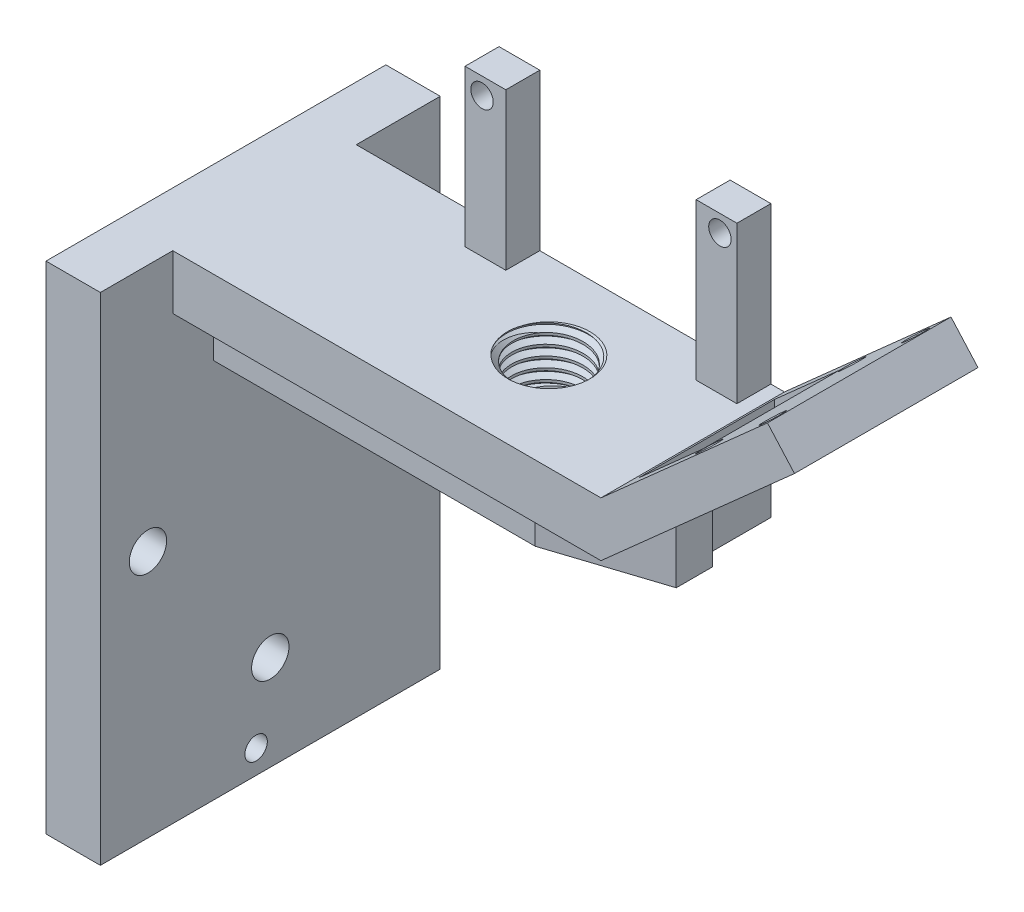
from build123d import *

# Parameters (mm, degrees)
BOSS_EXTRUDE2_DEPTH              = 17
FILLET4_R                        = 2
CUT_EXTRUDE3_DEPTH               = 54.344060179
CUT_EXTRUDE3_DEPTH_BACK          = 10
SKETCH5_R                        = 2.1
CUT_EXTRUDE4_DEPTH               = 54.344060179
FILLET5_R                        = 1
FILLET6_R                        = 1
CUT_EXTRUDE5_START               = -21
SKETCH7_W                        = 27.995529744
SKETCH7_H                        = 10
CUT_EXTRUDE5_DEPTH               = 8
SKETCH11_W                       = 70.995529744
SKETCH11_H                       = 8
BOSS_EXTRUDE4_DEPTH              = 27
M12X1_5_TAPPED_HOLE2_D           = 10.5
M12X1_5_TAPPED_HOLE2_CSINK_D     = 12.05
M12X1_5_TAPPED_HOLE2_CSINK_ANGLE = 90
THREAD1_PITCH                    = 1.5
BOSS_EXTRUDE9_REACH              = 61.78
SKETCH18_W                       = 6.15
SKETCH18_H                       = 9
SKETCH18_W_2                     = 10.891165303
BOSS_EXTRUDE10_DEPTH             = 5
SKETCH27_R                       = 1.65
CUT_EXTRUDE7_DEPTH               = 5
BOSS_EXTRUDE11_DEPTH             = 25
BOSS_EXTRUDE11_DEPTH_BACK        = 25
SKETCH28_W                       = 8
SKETCH28_H                       = 73
BOSS_EXTRUDE13_DEPTH             = 9
SKETCH30_R                       = 2.75
CUT_EXTRUDE8_DEPTH               = 25
BOSS_EXTRUDE14_START             = -12.65
BOSS_EXTRUDE14_DEPTH             = 27
SKETCH32_W                       = 9.502872963
SKETCH32_H                       = 20
CUT_EXTRUDE9_DEPTH               = 96.698444648
SKETCH34_R                       = 1.65
CUT_EXTRUDE10_DEPTH              = 5
SKETCH35_R                       = 1.65
CUT_EXTRUDE11_DEPTH              = 5


with BuildPart() as part:
    # Sketch2 → Boss-Extrude2 (new body)
    with BuildSketch(Plane(origin=(0, 10, 0), x_dir=(1, 0, 0), z_dir=(0, 1, 0))):
        Polygon((10.15, 21), (33.86, 21), (44.46, 11.73), (45.995529744, 10.387135781), (45.995529744, 5.080374985), (42.88, 4.07), (30.33, 0), (0, 0), (0, 10), align=None)
    extrude(amount=BOSS_EXTRUDE2_DEPTH)

    # Fillet4
    fillet4_edges = [part.edges().sort_by_distance(p)[0] for p in [
        (33.86, 18.5, -21),
    ]]
    fillet(fillet4_edges, radius=FILLET4_R)

    # Sketch5 → Cut-Extrude3 (cut, two sides: drawn at the far end of the back side and taken through both)
    with BuildSketch(Plane.XZ.offset(-10).offset(-CUT_EXTRUDE3_DEPTH_BACK)):
        with Locations(Location((4.5, -8.35, 0), (0, 0, 90))):
            Circle(SKETCH5_R)
        with Locations(Location((41.5, -8.35, 0), (0, 0, 90))):
            Circle(SKETCH5_R)
    extrude(amount=CUT_EXTRUDE3_DEPTH + CUT_EXTRUDE3_DEPTH_BACK, mode=Mode.SUBTRACT)

    # Sketch6 → Cut-Extrude4 (cut, through all)
    with BuildSketch(Plane.XZ.offset(-10)):
        with BuildLine():
            Line((6.75, -3.5), (29.776655589, -3.5))
            Line((29.776655589, -3.5), (37.633396178, -6.047962884))
            ThreePointArc((37.633396178, -6.047962884), (37.09151083, -9.252897134), (38.849712422, -11.986753463))
            Line((38.849712422, -11.986753463), (32.545460719, -17.5))
            Line((32.545460719, -17.5), (11.682803109, -17.5))
            Line((11.682803109, -17.5), (6.80567095, -12.214438054))
            ThreePointArc((6.80567095, -12.214438054), (8.999884249, -8.317723876), (6.75, -4.452885683))
            Line((6.75, -4.452885683), (6.75, -3.5))
        make_face()
    extrude(amount=-CUT_EXTRUDE4_DEPTH, mode=Mode.SUBTRACT)

    # Fillet5
    fillet5_edges = [part.edges().sort_by_distance(p)[0] for p in [
        (6.75, 18.5, -4.452885683),
    ]]
    fillet(fillet5_edges, radius=FILLET5_R)
    fillet5_2_edges = [part.edges().sort_by_distance(p)[0] for p in [
        (6.75, 18.5, -3.5),
    ]]
    fillet(fillet5_2_edges, radius=FILLET5_R - 0.0001)  # a hair under: the kernel refuses the full size

    # Fillet6
    fillet6_edges = [part.edges().sort_by_distance(p)[0] for p in [
        (29.776655589, 18.5, -3.5),
        (37.633396178, 18.5, -6.047962884),
        (38.849712422, 18.5, -11.986753463),
        (32.545460719, 18.5, -17.5),
        (11.682803109, 18.5, -17.5),
        (6.80567095, 18.5, -12.214438054),
    ]]
    fillet(fillet6_edges, radius=FILLET6_R)

    # Sketch7 → Cut-Extrude5 (cut)
    with BuildSketch(Plane(origin=(0, 0, -21), x_dir=(-1, 0, 0), z_dir=(0, 0, -1)).offset(CUT_EXTRUDE5_START)):
        with Locations((-22.997764872, 18.5)):
            Rectangle(SKETCH7_W, SKETCH7_H)
    extrude(amount=CUT_EXTRUDE5_DEPTH, mode=Mode.SUBTRACT)

    # Sketch11 → Boss-Extrude4 (add)
    with BuildSketch(Plane.XY.offset(-21)):
        with Locations((10.497764872, 23)):
            Rectangle(SKETCH11_W, SKETCH11_H)
    extrude(amount=BOSS_EXTRUDE4_DEPTH)

    # M12x1.5 Tapped Hole2 (through all)
    with Locations(Plane(origin=(0, 27, 0), x_dir=(1, 0, 0), z_dir=(0, 1, 0))):
        with Locations((24, 8.35)):
            CounterSinkHole(M12X1_5_TAPPED_HOLE2_D / 2, M12X1_5_TAPPED_HOLE2_CSINK_D / 2, counter_sink_angle=M12X1_5_TAPPED_HOLE2_CSINK_ANGLE)

    # Thread1: the profile of Thread Profile1 profile screwed along a right-hand helix of 6.666667 turns, 8 arcs to a turn; built about Z, then put on its axis
    thread1_z = Axis((0, 0, 0), (0, 0, 1))
    thread1_corners = [(5.2497, 0, -0.000173205), (6.061898812, 0, 0.468749998), (6.061898812, 0, 0.656249998), (5.2497, 0, 1.125173201)]
    with BuildLine(mode=Mode.PRIVATE) as thread1_profile:
        Line(thread1_corners[0], thread1_corners[1])
        Line(thread1_corners[1], thread1_corners[2])
        Line(thread1_corners[2], thread1_corners[3])
        Line(thread1_corners[3], thread1_corners[0])
    thread1_cap = Face(thread1_profile.wire())
    thread1_turn_angles = [0, 22.5, 45, 67.5, 90, 112.5, 135, 157.5, 180, 202.5, 225, 247.5, 270, 292.5, 315, 337.5, 360]
    thread1_turn_weights = [1, 0.9238795325112867, 1, 0.9238795325112867, 1, 0.9238795325112867, 1, 0.9238795325112867, 1, 0.9238795325112867, 1, 0.9238795325112867, 1, 0.9238795325112867, 1, 0.9238795325112867, 1]
    thread1_turn_rails = [Edge.make_bspline([Vector(p[0], p[1], 0).rotate(thread1_z, thread1_turn_angles[k]) / thread1_turn_weights[k] + Vector(0, 0, p[2] + THREAD1_PITCH * thread1_turn_angles[k] / 360) for k in range(17)], [0, 0, 0, 1, 1, 2, 2, 3, 3, 4, 4, 5, 5, 6, 6, 7, 7, 8, 8, 8], 2, thread1_turn_weights) for p in thread1_corners]
    thread1_turn_sides = [Face.make_surface_from_curves(thread1_turn_rails[p[0]], thread1_turn_rails[p[1]]) for p in [(0, 1), (1, 2), (2, 3), (3, 0)]]
    thread1_last_angles = [2160, 2182.5, 2205, 2227.5, 2250, 2272.5, 2295, 2317.5, 2340, 2362.5, 2385, 2392.5, 2400]
    thread1_last_weights = [1, 0.9238795325112867, 1, 0.9238795325112867, 1, 0.9238795325112867, 1, 0.9238795325112867, 1, 0.9238795325112867, 1, 0.9914448613738104, 1]
    thread1_last_rails = [Edge.make_bspline([Vector(p[0], p[1], 0).rotate(thread1_z, thread1_last_angles[k]) / thread1_last_weights[k] + Vector(0, 0, p[2] + THREAD1_PITCH * thread1_last_angles[k] / 360) for k in range(13)], [0, 0, 0, 1, 1, 2, 2, 3, 3, 4, 4, 5, 5, 6, 6, 6], 2, thread1_last_weights) for p in thread1_corners]
    thread1_last_sides = [Face.make_surface_from_curves(thread1_last_rails[p[0]], thread1_last_rails[p[1]]) for p in [(0, 1), (1, 2), (2, 3), (3, 0)]]
    thread1 = Plane(origin=(24, 29, -8.35), x_dir=(-1, 0, 0), z_dir=(0, -1, 0)) * Solid(Shell([*[p.moved(Location((0, 0, THREAD1_PITCH * i))) for i in range(6) for p in thread1_turn_sides], *thread1_last_sides, thread1_cap, thread1_cap.rotate(thread1_z, 2400).moved(Location((0, 0, THREAD1_PITCH * 2400 / 360)))]))
    add(thread1, mode=Mode.SUBTRACT)

    # Sketch18 → Boss-Extrude9 (add, up to next)
    with BuildSketch(Plane.XY.offset(-21), mode=Mode.PRIVATE) as boss_extrude9_sk1:
        with Locations((7.075, 14.5)):
            Rectangle(SKETCH18_W, SKETCH18_H)
    boss_extrude9_tool1 = extrude(boss_extrude9_sk1.sketch, amount=BOSS_EXTRUDE9_REACH, mode=Mode.PRIVATE) - part.part
    # Sketch18 → Boss-Extrude9 (add, up to next)
    with BuildSketch(Plane.XY.offset(-21), mode=Mode.PRIVATE) as boss_extrude9_sk2:
        with Locations((38.554417348, 14.5)):
            Rectangle(SKETCH18_W_2, SKETCH18_H)
    boss_extrude9_tool2 = extrude(boss_extrude9_sk2.sketch, amount=BOSS_EXTRUDE9_REACH, mode=Mode.PRIVATE) - part.part
    add(boss_extrude9_tool1.solids().sort_by_distance((7.075, 14.5, -21))[0])
    add(boss_extrude9_tool2.solids().sort_by_distance((38.554417, 14.5, -21))[0])

    # Sketch18<3> → Boss-Extrude10 (add)
    with BuildSketch(Plane.XY.offset(-21)):
        Polygon((4, 10), (44, 10), (44, 50), (38, 50), (38, 27), (10, 27), (10, 50), (4, 50), align=None)
    extrude(amount=BOSS_EXTRUDE10_DEPTH)

    # Sketch27 → Cut-Extrude7 (cut)
    with BuildSketch(Plane.XY.offset(-21)):
        with Locations((6.5, 47.5)):
            Circle(SKETCH27_R)
        with Locations((6.5, 12.5)):
            Circle(SKETCH27_R)
        with Locations((41.5, 12.5)):
            Circle(SKETCH27_R)
        with Locations((41.5, 47.5)):
            Circle(SKETCH27_R)
    extrude(amount=CUT_EXTRUDE7_DEPTH, mode=Mode.SUBTRACT)

    # Sketch28 → Boss-Extrude11 (add, two sides: drawn at the far end of the back side and taken through both)
    with BuildSketch(Plane.XY.offset(-8.35).offset(-BOSS_EXTRUDE11_DEPTH_BACK)):
        with Locations((-21, -9.5)):
            Rectangle(SKETCH28_W, SKETCH28_H)
    extrude(amount=BOSS_EXTRUDE11_DEPTH + BOSS_EXTRUDE11_DEPTH_BACK)

    # Sketch29 → Boss-Extrude13 (add)
    with BuildSketch(Plane(origin=(0, 19, -40), x_dir=(1, 0, 0), z_dir=(0, -1, 0))):
        Polygon((-17, 40), (0, 40), (0, 30), (4, 25.665024631), (4, 19), (-17, 19), align=None)
    extrude(amount=BOSS_EXTRUDE13_DEPTH)

    # Sketch30 → Cut-Extrude8 (cut)
    with BuildSketch(Plane(origin=(-17, 0, -7), x_dir=(0, 0, -1), z_dir=(1, 0, 0))):
        with Locations(Location((19.35, -9.5, 0), (0, 0, 90))):
            Circle(SKETCH30_R)
        with Locations(Location((-16.65, -9.5, 0), (0, 0, 90))):
            Circle(SKETCH30_R)
        with Locations(Location((1.35, 13, 0), (0, 0, 90))):
            Circle(SKETCH30_R)
        with Locations(Location((1.35, -32, 0), (0, 0, 90))):
            Circle(SKETCH30_R)
    extrude(amount=-CUT_EXTRUDE8_DEPTH, mode=Mode.SUBTRACT)

    # Sketch31 → Boss-Extrude14 (add)
    with BuildSketch(Plane.XY.offset(-8.35).offset(BOSS_EXTRUDE14_START)):
        Polygon((45.995529744, 27), (60.039172169, 39.495402441), (70.498402707, 48.801556134), (74.471268295, 44.336433544), (64.012037756, 35.030279851), (45.995529744, 19), align=None)
    extrude(amount=BOSS_EXTRUDE14_DEPTH)

    # Sketch32 → Cut-Extrude9 (cut, through all)
    with BuildSketch(Plane(origin=(0, 0, 0), x_dir=(1, 0, 0), z_dir=(0, 1, 0))):
        with Locations((52.746966226, 7.5)):
            Rectangle(SKETCH32_W, SKETCH32_H)
    extrude(amount=CUT_EXTRUDE9_DEPTH, mode=Mode.SUBTRACT)

    # Sketch34 → Cut-Extrude10 (cut)
    with BuildSketch(Plane(origin=(6.915148524, -7.771968421, 0), x_dir=(0.7470878956010979, 0.6647252637340657, 0), z_dir=(-0.6647252637340657, 0.7470878956010979, 0))):
        with Locations(Location((82.108130593, 18, 0), (0, 0, 180))):
            Circle(SKETCH34_R)
        with Locations(Location((69.608130593, 18, 0), (0, 0, 180))):
            Circle(SKETCH34_R)
        with Locations(Location((69.608130593, -3, 0), (0, 0, 180))):
            Circle(SKETCH34_R)
        with Locations(Location((82.108130593, -3, 0), (0, 0, 180))):
            Circle(SKETCH34_R)
    extrude(amount=-CUT_EXTRUDE10_DEPTH, mode=Mode.SUBTRACT)

    # Sketch35 → Cut-Extrude11 (cut)
    with BuildSketch(Plane(origin=(-17, 0, -17), x_dir=(0, 0, -1), z_dir=(1, 0, 0))):
        with Locations(Location((-10.735175187, 6.5, 0), (0, 0, 90))):
            Circle(SKETCH35_R)
        with Locations(Location((-10.735175187, -42.5, 0), (0, 0, 90))):
            Circle(SKETCH35_R)
    extrude(amount=-CUT_EXTRUDE11_DEPTH, mode=Mode.SUBTRACT)


solid = part.part
